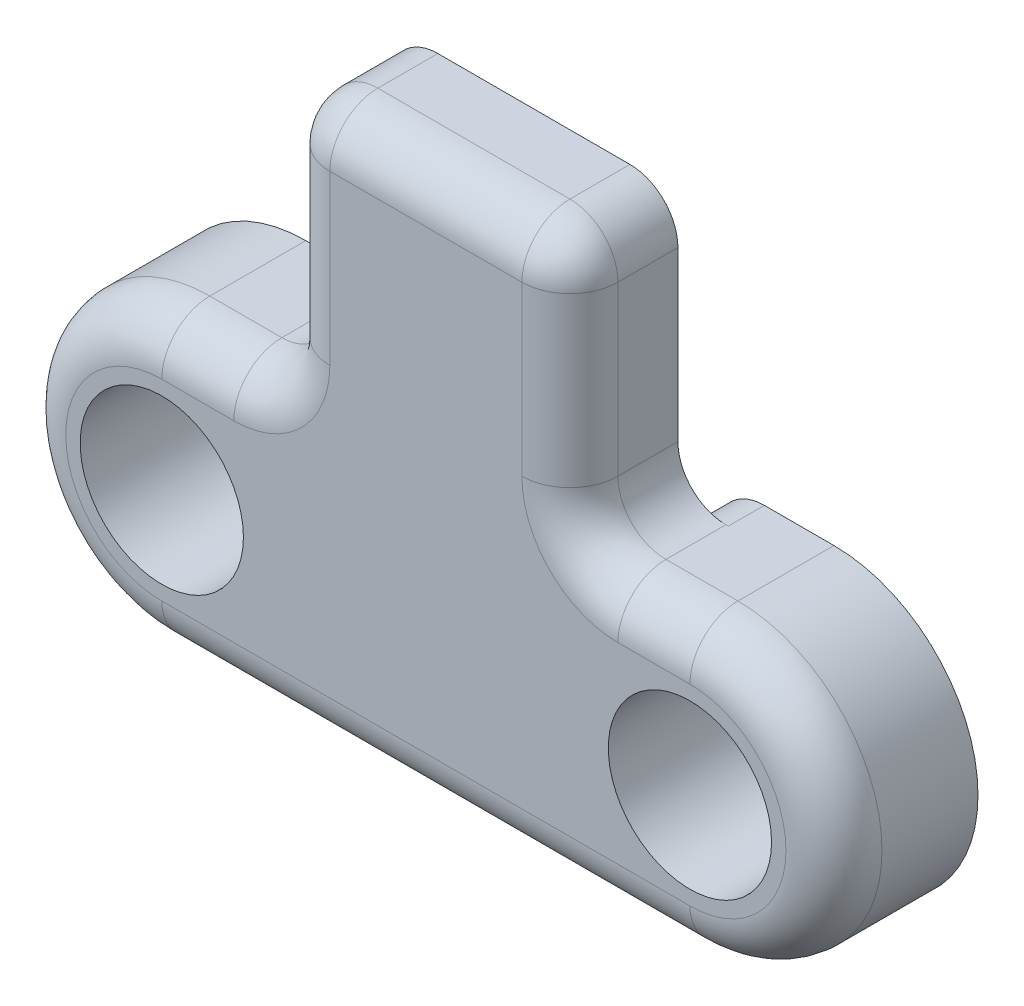
from build123d import *

# Parameters (mm, degrees)
SKETCH1_R               = 1.7
SKETCH1_W               = 6
SKETCH1_H               = 5.5
BOSS_EXTRUDE1_DEPTH     = 3
CUT_EXTRUDE1_DEPTH      = 13.389511693
CUT_EXTRUDE1_DEPTH_BACK = 13.389511693
SKETCH2_W               = 6.1
SKETCH2_H               = 0.75
FILLET2_R               = 1
FILLET1_R               = 1


with BuildPart() as part:
    # Sketch1 → Boss-Extrude1 (new body)
    # profile 1 of 2: a face of its own
    with BuildSketch(Plane.XY):
        with BuildLine():
            Line((-5.5, 3), (5.5, 3))
            ThreePointArc((5.5, 3), (8.5, 0), (5.5, -3))
            Line((5.5, -3), (-5.5, -3))
            ThreePointArc((-5.5, -3), (-8.5, 0), (-5.5, 3))
        make_face()
        with Locations((5.5, 0)):
            Circle(SKETCH1_R, mode=Mode.SUBTRACT)
        with Locations((-5.5, 0)):
            Circle(SKETCH1_R, mode=Mode.SUBTRACT)
    # profile 2 of 2: a face of its own
    with BuildSketch(Plane.XY):
        with Locations((0, 5.75)):
            Rectangle(SKETCH1_W, SKETCH1_H)
    extrude(amount=BOSS_EXTRUDE1_DEPTH)

    # Sketch2 → Cut-Extrude1 (cut, two sides: drawn at the far end of the back side and taken through both)
    with BuildSketch(Plane(origin=(0, 0, 0), x_dir=(1, 0, 0), z_dir=(0, 1, 0)).offset(-CUT_EXTRUDE1_DEPTH_BACK)):
        with Locations((0, -0.375)):
            Rectangle(SKETCH2_W, SKETCH2_H)
    extrude(amount=CUT_EXTRUDE1_DEPTH + CUT_EXTRUDE1_DEPTH_BACK, mode=Mode.SUBTRACT)

    # Fillet2
    fillet2_edges = [part.edges().sort_by_distance(p)[0] for p in [
        (3, 3, 1.875),
        (-3, 3, 1.875),
        (3, 8.5, 1.875),
        (-3, 8.5, 1.875),
    ]]
    fillet(fillet2_edges, radius=FILLET2_R)

    # Fillet1
    # the kernel refuses this fillet: 1 mm, written as the material it takes off along each edge
    with BuildSketch(Plane(origin=(-5.5, 0, 3), x_dir=(0, -1, 0), z_dir=(1, 0, 0))) as fillet1_piece_1:
        with BuildLine():
            CenterArc((3 - FILLET1_R, FILLET1_R), FILLET1_R, 270, 90)
            Line((3, FILLET1_R), (3, 0))
            Line((3, 0), (3 - FILLET1_R, 0))
        make_face()
    revolve(axis=Axis((-5.5, 0, 3), (0, 0, -1)), revolution_arc=180, mode=Mode.SUBTRACT)
    with BuildSketch(Plane(origin=(5.5, -3, 3), x_dir=(0, 0, -1), z_dir=(-1, 0, 0))) as fillet1_piece_2:
        with BuildLine():
            CenterArc((FILLET1_R, -FILLET1_R), FILLET1_R, 90, 90)
            Line((0, -FILLET1_R), (0, 0))
            Line((0, 0), (FILLET1_R, 0))
        make_face()
    extrude(amount=11, mode=Mode.SUBTRACT)
    with BuildSketch(Plane(origin=(5.5, 0, 3), x_dir=(0, 1, 0), z_dir=(-1, 0, 0))) as fillet1_piece_3:
        with BuildLine():
            CenterArc((3 - FILLET1_R, FILLET1_R), FILLET1_R, 270, 90)
            Line((3 - FILLET1_R, 0), (3, 0))
            Line((3, 0), (3, FILLET1_R))
        make_face()
    revolve(axis=Axis((5.5, 0, 3), (0, 0, -1)), revolution_arc=180, mode=Mode.SUBTRACT)
    with BuildSketch(Plane(origin=(3.05, -3, -2.5), x_dir=(0, 1, 0), z_dir=(0, 0, 1))) as fillet1_piece_4:
        with BuildLine():
            CenterArc((FILLET1_R, -FILLET1_R), FILLET1_R, 90, 90)
            Line((0, -FILLET1_R), (0, 0))
            Line((0, 0), (FILLET1_R, 0))
        make_face()
    extrude(amount=3.25, mode=Mode.SUBTRACT)
    with BuildSketch(Plane(origin=(-3.05, -3, 0.75), x_dir=(-1, 0, 0), z_dir=(0, 0, -1))) as fillet1_piece_5:
        with BuildLine():
            CenterArc((FILLET1_R, FILLET1_R), FILLET1_R, 180, 90)
            Line((0, FILLET1_R), (0, 0))
            Line((0, 0), (FILLET1_R, 0))
        make_face()
    extrude(amount=3.25, mode=Mode.SUBTRACT)
    with BuildSketch(Plane(origin=(-5.5, 3, 3), x_dir=(0, -1, 0), z_dir=(1, 0, 0))) as fillet1_piece_6:
        with BuildLine():
            CenterArc((FILLET1_R, FILLET1_R), FILLET1_R, 180, 90)
            Line((0, FILLET1_R), (0, 0))
            Line((0, 0), (FILLET1_R, 0))
        make_face()
    extrude(amount=1.5, mode=Mode.SUBTRACT)
    with BuildSketch(Plane(origin=(4, 3, 3), x_dir=(0, 0, -1), z_dir=(1, 0, 0))) as fillet1_piece_7:
        with BuildLine():
            CenterArc((FILLET1_R, -FILLET1_R), FILLET1_R, 90, 90)
            Line((0, -FILLET1_R), (0, 0))
            Line((0, 0), (FILLET1_R, 0))
        make_face()
    extrude(amount=1.5, mode=Mode.SUBTRACT)
    with BuildSketch(Plane(origin=(4, 4, 3), x_dir=(0, -1, 0), z_dir=(1, 0, 0))) as fillet1_piece_8:
        with BuildLine():
            CenterArc((1 + FILLET1_R, FILLET1_R), FILLET1_R, 180, 90)
            Line((1 + FILLET1_R, 0), (1, 0))
            Line((1, 0), (1, FILLET1_R))
        make_face()
    revolve(axis=Axis((4, 4, 3), (0, 0, -1)), revolution_arc=90, mode=Mode.SUBTRACT)
    with BuildSketch(Plane(origin=(3, 4, 3), x_dir=(-1, 0, 0), z_dir=(0, 1, 0)), Plane(origin=(-3, 7.5, 3), x_dir=(1, 0, 0), z_dir=(0, -1, 0))) as fillet1_piece_9:
        with BuildLine():
            CenterArc((FILLET1_R, -FILLET1_R), FILLET1_R, 90, 90)
            Line((0, -FILLET1_R), (0, 0))
            Line((0, 0), (FILLET1_R, 0))
        make_face()
    extrude(amount=3.5, mode=Mode.SUBTRACT)
    with BuildSketch(Plane(origin=(2, 7.5, 3), x_dir=(0, 1, 0), z_dir=(-1, 0, 0))) as fillet1_piece_10:
        with BuildLine():
            CenterArc((1 - FILLET1_R, FILLET1_R), FILLET1_R, 270, 90)
            Line((1, FILLET1_R), (1, 0))
            Line((1, 0), (1 - FILLET1_R, 0))
        make_face()
    revolve(axis=Axis((2, 7.5, 3), (0, 0, -1)), revolution_arc=90, mode=Mode.SUBTRACT)
    with BuildSketch(Plane(origin=(2, 8.5, 3), x_dir=(0, -1, 0), z_dir=(-1, 0, 0))) as fillet1_piece_11:
        with BuildLine():
            CenterArc((FILLET1_R, -FILLET1_R), FILLET1_R, 90, 90)
            Line((0, -FILLET1_R), (0, 0))
            Line((0, 0), (FILLET1_R, 0))
        make_face()
    extrude(amount=4, mode=Mode.SUBTRACT)
    with BuildSketch(Plane(origin=(-2, 7.5, 3), x_dir=(-1, 0, 0), z_dir=(0, -1, 0))) as fillet1_piece_12:
        with BuildLine():
            CenterArc((1 - FILLET1_R, FILLET1_R), FILLET1_R, 270, 90)
            Line((1, FILLET1_R), (1, 0))
            Line((1, 0), (1 - FILLET1_R, 0))
        make_face()
    revolve(axis=Axis((-2, 7.5, 3), (0, 0, -1)), revolution_arc=90, mode=Mode.SUBTRACT)
    with BuildSketch(Plane(origin=(-4, 4, 3), x_dir=(0, -1, 0), z_dir=(-1, 0, 0))) as fillet1_piece_13:
        with BuildLine():
            CenterArc((1 + FILLET1_R, -FILLET1_R), FILLET1_R, 90, 90)
            Line((1, -FILLET1_R), (1, 0))
            Line((1, 0), (1 + FILLET1_R, 0))
        make_face()
    revolve(axis=Axis((-4, 4, 3), (0, 0, 1)), revolution_arc=90, mode=Mode.SUBTRACT)
    with BuildSketch(Plane(origin=(-3.05, 3.6877501, -4.21937525), x_dir=(0, -1, 0), z_dir=(0, 0, 1))) as fillet1_piece_14:
        with BuildLine():
            CenterArc((1.6877501, -1), FILLET1_R, 90, 90)
            Line((0.6877501, -1), (0.5877501, -1))
            ThreePointArc((0.5877501, -1), (0.5877501, -0.95), (-0.03122499, -0.095))
            Line((-0.03122499, -0.095), (0, 0.1))
            Line((0, 0.1), (1.6877501, 0.1))
            Line((1.6877501, 0.1), (1.6877501, 0))
        make_face()
    extrude(amount=4.96937525, mode=Mode.SUBTRACT)
    with BuildSketch(Plane(origin=(3.05, 3.6877501, -4.21937525), x_dir=(0.8239457103973873, -0.5666687447863566, 0), z_dir=(0, 0, 1))) as fillet1_piece_15:
        with BuildLine():
            CenterArc((1.780340941, -0.82394571), FILLET1_R, 124.51825235, 90)
            Line((0.956395231, -1.390614455), (0.87400066, -1.44728133))
            Line((0.87400066, -1.44728133), (-0.082394571, -0.056666874))
            Line((-0.082394571, -0.056666874), (0.060580617, 0.079561227))
            ThreePointArc((0.060580617, 0.079561227), (1.115808036, 0.054061134), (1.157005322, 0.082394571))
            Line((1.157005322, 0.082394571), (1.213672196, 0))
        make_face()
    extrude(amount=4.96937525, mode=Mode.SUBTRACT)


solid = part.part
